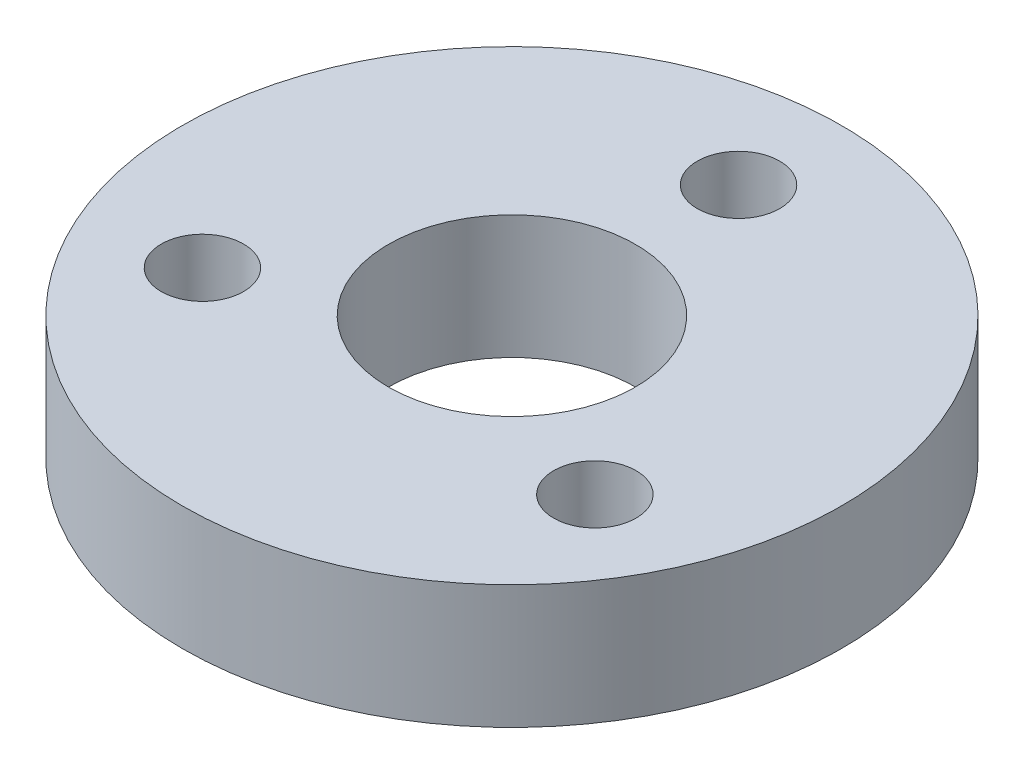
from build123d import *

# Parameters (mm, degrees)
SKETCH1_R           = 8
SKETCH1_R_2         = 3
SKETCH1_R_3         = 1
BOSS_EXTRUDE1_DEPTH = 3


with BuildPart() as part:
    # Sketch1 → Boss-Extrude1 (new body)
    with BuildSketch(Plane(origin=(0, 0, 0), x_dir=(1, 0, 0), z_dir=(0, 1, 0))):
        Circle(SKETCH1_R)
        Circle(SKETCH1_R_2, mode=Mode.SUBTRACT)
        with Locations((0, 5.5)):
            Circle(SKETCH1_R_3, mode=Mode.SUBTRACT)
        with Locations((4.763139721, -2.75)):
            Circle(SKETCH1_R_3, mode=Mode.SUBTRACT)
        with Locations((-4.763139721, -2.75)):
            Circle(SKETCH1_R_3, mode=Mode.SUBTRACT)
    extrude(amount=BOSS_EXTRUDE1_DEPTH)


solid = part.part
